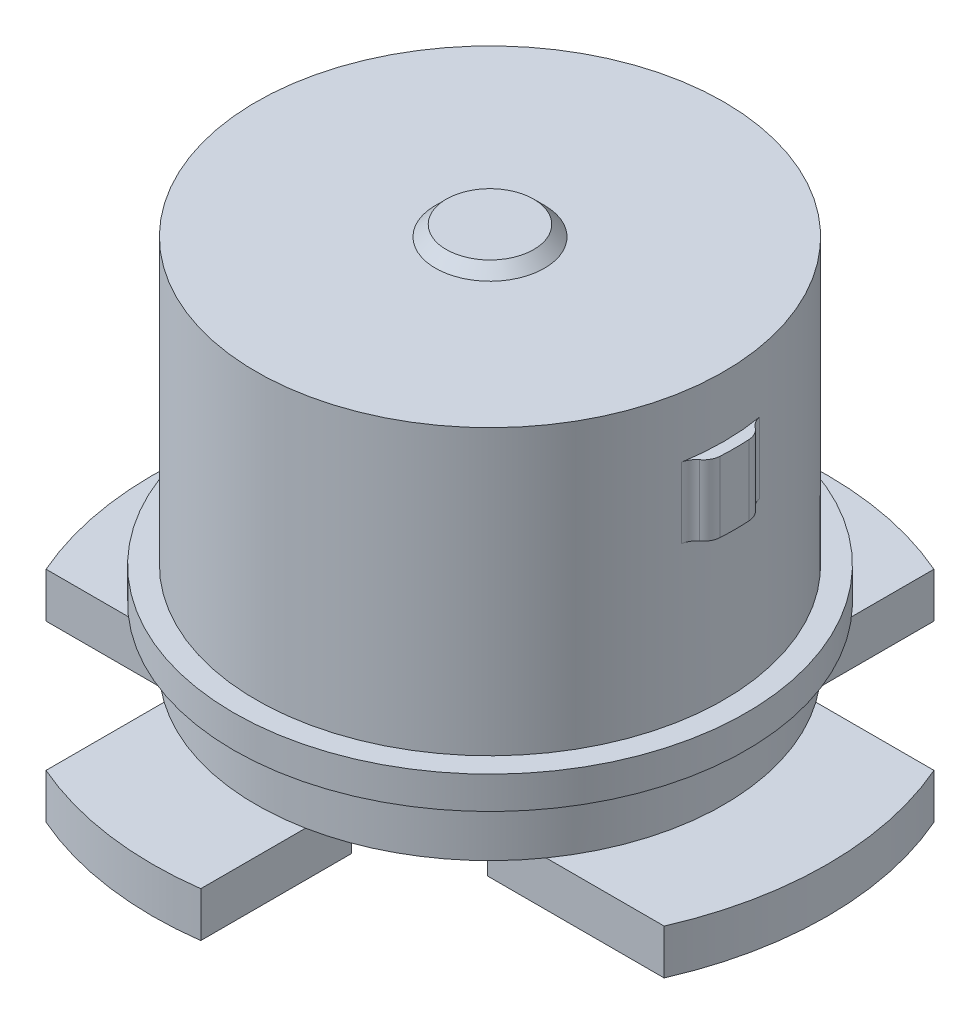
from build123d import *

# Parameters (mm, degrees)
FILLET1_R          = 4.064
SKETCH10_W         = 2.857500069
SKETCH10_H         = 7.5184
REVOLVE3_ANGLE     = 20
CUT_EXTRUDE1_START = 1.27
CUT_EXTRUDE1_DEPTH = 4.9784
CIRPATTERN4_COUNT  = 2
FILLET8_R          = 1.27
FILLET9_R          = 1.27
SKETCH13_W         = 23.8125
SKETCH13_H         = 35.179
SKETCH14_W         = 18.870013955
SKETCH14_H         = 18.870013955
SKETCH14_W_2       = 25.220013955
SKETCH14_H_2       = 25.220013955
CUT_EXTRUDE2_DEPTH = 3.175
SKETCH17_W         = 13.335
SKETCH17_H         = 31.241914403


with BuildPart() as part:
    # Sketch1 → Revolve1 (revolve)
    with BuildSketch(Plane.XY, mode=Mode.PRIVATE) as revolve1_sk:
        Polygon((0, 9.1059), (-20.6375, 9.1059), (-20.6375, 5.042647059), (-17.78, 5.042647059), (-17.78, -5.042647059), (-20.6375, -5.042647059), (-20.6375, -19.7231), (-16.51, -19.7231), (-16.51, -15.5956), (-18.0975, -15.5956), (-18.0975, -13.3096), (-16.51, -13.3096), (-16.51, 6.7564), (-3.8481, 6.7564), (-3.0861, 7.5184), (0, 7.5184), align=None)
    revolve(revolve1_sk.sketch.rotate(Axis((0, 0, 0), (0, 1, 0)), 270), axis=Axis((0, 0, 0), (0, 1, 0)))

    # Fillet1
    # the kernel refuses this fillet: 4.064 mm, written as the material it takes off along each edge
    with BuildSketch(Plane(origin=(0, 9.1059, 0), x_dir=(0, 0, -1), z_dir=(1, 0, 0))) as fillet1_piece_1:
        with BuildLine():
            CenterArc((16.573500069, -4.064), FILLET1_R, 0.010532312, 89.989467688)
            Line((20.6375, -4.063252941), (20.718779999, -4.063238))
            Line((20.718779999, -4.063238), (20.71878, 0))
            Line((20.71878, 0), (20.6375, 0.08128))
            Line((20.6375, 0.08128), (16.573500069, 0.08128))
            Line((16.573500069, 0.08128), (16.573500069, 0))
        make_face()
    revolve(axis=Axis((0, 9.1059, 0), (0, 1, 0)), mode=Mode.SUBTRACT)

    # Sketch10 → Revolve3 (revolve, symmetric)
    with BuildSketch(Plane.XY) as revolve3_sk:
        with Locations((-19.208750034, 0)):
            Rectangle(SKETCH10_W, SKETCH10_H)
    revolve3 = revolve(axis=Axis((0, 0, 0), (0, 1, 0)), revolution_arc=REVOLVE3_ANGLE / 2)
    revolve3 = revolve3 + revolve(revolve3_sk.sketch, axis=Axis((0, 0, 0), (0, -1, 0)), revolution_arc=REVOLVE3_ANGLE / 2)

    # Sketch12 → Cut-Extrude1 (cut)
    with BuildSketch(Plane(origin=(0, -3.7592, 0), x_dir=(1, 0, 0), z_dir=(0, 1, 0)).offset(CUT_EXTRUDE1_START)):
        with BuildLine():
            Line((-7.313638514, 0), (-17.215440903, 1.745954919))
            ThreePointArc((-17.215440903, 1.745954919), (-17.30375, 0), (-17.215440903, -1.745954919))
            Line((-17.215440903, -1.745954919), (-7.313638514, 0))
        make_face()
    cut_extrude1 = extrude(amount=CUT_EXTRUDE1_DEPTH, mode=Mode.SUBTRACT)

    # CirPattern4: Revolve3, Cut-Extrude1 ×2 about axis
    cirpattern4_axis = Axis((0, 0, 0), (0, 1, 0))
    add([revolve3.rotate(cirpattern4_axis, i * 360 / CIRPATTERN4_COUNT) for i in range(1, CIRPATTERN4_COUNT)])
    add([cut_extrude1.rotate(cirpattern4_axis, i * 360 / CIRPATTERN4_COUNT) for i in range(1, CIRPATTERN4_COUNT)], mode=Mode.SUBTRACT)

    # Fillet8
    # the kernel refuses this fillet: 1.27 mm, written as the material it takes off along each edge
    with BuildSketch(Plane(origin=(-16.431533746, -2.4892, -1.607730937), x_dir=(0.1324793231915166, 0, -0.9911857691304479), z_dir=(0, 1, 0)), Plane(origin=(16.431533746, -2.4892, 1.607730937), x_dir=(-0.13247932319151873, 0, 0.9911857691304475), z_dir=(0, 1, 0))) as fillet8_piece_1:
        with BuildLine():
            CenterArc((1.211424462, 1.269207194), FILLET8_R, 201.909884157, 66.065503548)
            Line((0.033154154, 0.795309438), (0.009588748, 0.785831483))
            ThreePointArc((0.009588748, 0.785831483), (-0.008800881, 0.398712653), (-0.025377958, 0.001057934))
            Line((-0.025377958, 0.001057934), (0.000897351, -0.025384144))
            ThreePointArc((0.000897351, -0.025384144), (0.583278445, -0.01509352), (1.165659538, -0.025384144))
            Line((1.165659538, -0.025384144), (1.166556889, 0))
        make_face()
    extrude(amount=4.9784, mode=Mode.SUBTRACT)
    with BuildSketch(Plane(origin=(-16.431533746, -2.4892, 1.607730937), x_dir=(0.13247932319152245, 0, 0.9911857691304472), z_dir=(0, 1, 0)), Plane(origin=(16.431533746, -2.4892, -1.607730937), x_dir=(-0.13247932319151992, 0, -0.9911857691304475), z_dir=(0, 1, 0))) as fillet8_piece_2:
        with BuildLine():
            CenterArc((1.211424462, -1.269207194), FILLET8_R, 92.024612295, 66.065503548)
            Line((0.033154154, -0.795309438), (0.009588748, -0.785831483))
            ThreePointArc((0.009588748, -0.785831483), (-0.008800881, -0.398712653), (-0.025377958, -0.001057934))
            Line((-0.025377958, -0.001057934), (0.000897351, 0.025384144))
            ThreePointArc((0.000897351, 0.025384144), (0.583278445, 0.01509352), (1.165659538, 0.025384144))
            Line((1.165659538, 0.025384144), (1.166556889, 0))
        make_face()
    extrude(amount=4.9784, mode=Mode.SUBTRACT)

    # Fillet9
    fillet9_edges = [part.edges().sort_by_distance(p)[0] for p in [
        (-17.215440903, 0, 1.745954919),
        (-17.215440903, 0, -1.745954919),
        (17.215440903, 0, -1.745954919),
        (17.215440903, 0, 1.745954919),
    ]]
    fillet(fillet9_edges, radius=FILLET9_R)


with BuildPart() as body_2:
    # Sketch13 → Revolve4 (revolve)
    with BuildSketch(Plane.XY):
        with Locations((-11.90625, -5.3086)):
            Rectangle(SKETCH13_W, SKETCH13_H)
    revolve(axis=Axis((0, 12.2809, 0), (0, -1, 0)))

    # Intersect1: read off the stored shape, not the designer's step
    # Intersect1: cut part
    add(part.part, mode=Mode.SUBTRACT)

    # Sketch14 → Cut-Extrude2 (cut)
    with BuildSketch(Plane.XZ.offset(22.8981)):
        with Locations((-18.960006978, 18.960006978)):
            Rectangle(SKETCH14_W, SKETCH14_H)
        with Locations((15.785006978, 18.960006978)):
            Rectangle(SKETCH14_W_2, SKETCH14_H)
        with Locations((-18.960006978, -15.785006978)):
            Rectangle(SKETCH14_W, SKETCH14_H_2)
        with Locations((18.960006978, -18.960006978)):
            Rectangle(SKETCH14_W, SKETCH14_H)
    extrude(amount=-CUT_EXTRUDE2_DEPTH, mode=Mode.SUBTRACT)

    # Sketch16 → Cut-Revolve4 (revolve, cut)
    with BuildSketch(Plane.XY):
        Polygon((17.616090936, -19.7231), (24.456472079, -19.7231), (24.456472079, 14.393066261), (0, 14.393066261), (0, 7.5184), (17.616090936, 7.5184), (17.616090936, -12.224103068), (18.894097, -12.224103068), (18.894097, -16.204339712), (17.616090936, -16.204339712), align=None)
    revolve(axis=Axis((0, 0, 0), (0, -1, 0)), mode=Mode.SUBTRACT)

    # Sketch17 → Cut-Revolve5 (revolve, cut)
    with BuildSketch(Plane.XY, mode=Mode.PRIVATE) as cut_revolve5_sk:
        with Locations((6.6675, -12.039557201)):
            Rectangle(SKETCH17_W, SKETCH17_H)
    revolve(cut_revolve5_sk.sketch.rotate(Axis((0, 3.5814, 0), (0, -1, 0)), 180), axis=Axis((0, 3.5814, 0), (0, -1, 0)), mode=Mode.SUBTRACT)


solid = body_2.part
